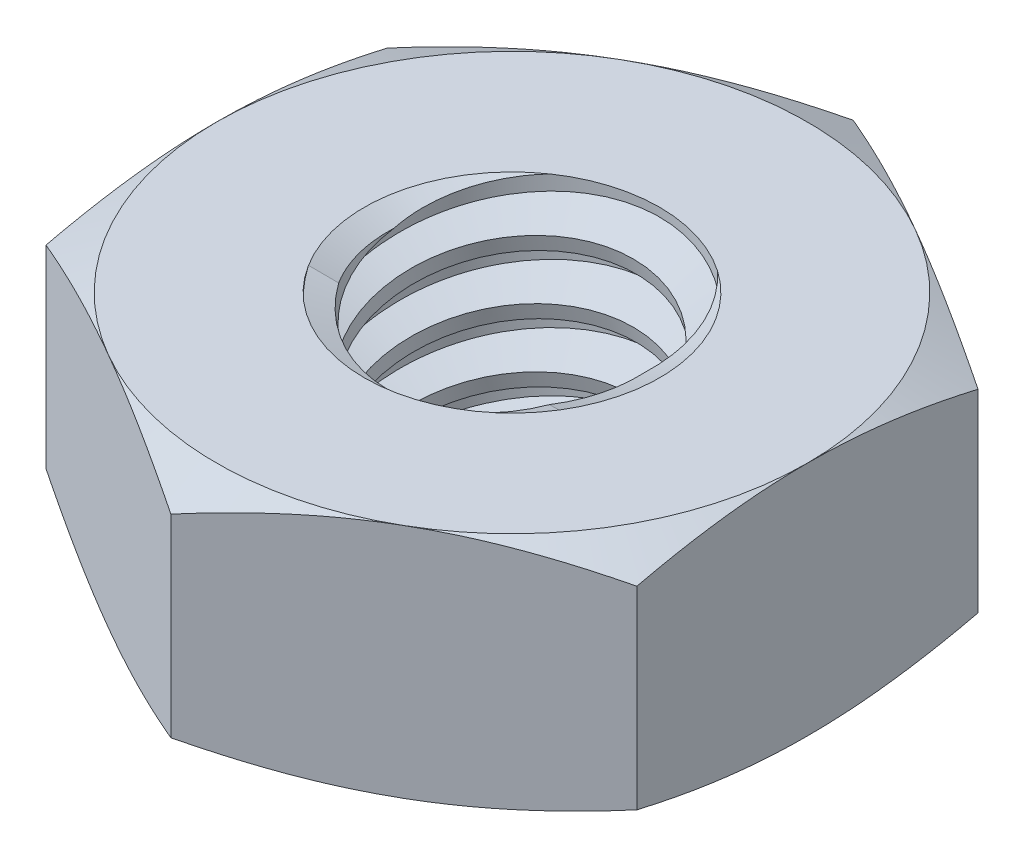
from build123d import *

# Parameters (mm, degrees)
EXTRUDE1_DEPTH       = 0.8
SKETCH2_W            = 1
SKETCH2_H            = 1.6
LPATTERN1_COUNT      = 4
LPATTERN1_PITCH      = 0.4
LPATTERN1_COUNT_DIR2 = 2
LPATTERN1_PITCH_DIR2 = 0.4


with BuildPart() as part:
    # Sketch1 → Extrude1 (new, symmetric)
    with BuildSketch(Plane(origin=(0, 0, 0), x_dir=(1, 0, 0), z_dir=(0, 1, 0))):
        Polygon((0, 2.309401077), (-2, 1.154700538), (-2, -1.154700538), (0, -2.309401077), (2, -1.154700538), (2, 1.154700538), align=None)
    extrude(amount=EXTRUDE1_DEPTH, both=True)

    # Sketch4 → Cut-Revolve2 (revolve, cut)
    with BuildSketch(Plane(origin=(0, 0, 0), x_dir=(0, 0, -1), z_dir=(1, 0, 0))):
        Polygon((0, 0.8), (1, 0.8), (0.82201838, 0.717005807), (0.82201838, -0.717005807), (1, -0.8), (0, -0.8), align=None)
    revolve(axis=Axis((0, 0.8, 0), (0, 1, 0)), mode=Mode.SUBTRACT)


with BuildPart() as body_2:
    # Sketch2 → Revolve1 (revolve)
    with BuildSketch(Plane(origin=(0, 0, 0), x_dir=(0, 0, -1), z_dir=(1, 0, 0))):
        with Locations((0.5, 0)):
            Rectangle(SKETCH2_W, SKETCH2_H)
    revolve(axis=Axis((0, -1.8, 0), (0, 1, 0)))

    # Sketch3 → Cut-Revolve1 (revolve, cut)
    with BuildSketch(Plane(origin=(0, 0, 0), x_dir=(0, 0, -1), z_dir=(1, 0, 0))):
        Polygon((1.009805807, 0.750970966), (1.078446454, 0.40776773), (0.841629993, 0.487879925), (0.82201838, 0.585937993), align=None)
    cut_revolve1 = revolve(axis=Axis((0, 0.8, 0.085891176), (0, -0.9805806756909201, -0.19611613513818438)), mode=Mode.SUBTRACT)

    # LPattern1: Cut-Revolve1 4 × 2
    with Locations(*[Vector(0, -1, 0) * (i * LPATTERN1_PITCH) + Vector(0, 1, 0) * (j * LPATTERN1_PITCH_DIR2) for i in range(LPATTERN1_COUNT) for j in range(LPATTERN1_COUNT_DIR2) if (i, j) != (0, 0)]):
        add(cut_revolve1, mode=Mode.SUBTRACT)


with BuildPart() as part_1:
    add(part.part)

    # Combine1: cut body 2
    add(body_2.part, mode=Mode.SUBTRACT)

    # Sketch5 → Cut-Revolve3 (revolve, cut)
    with BuildSketch(Plane(origin=(0, 0, 0), x_dir=(0, 0, -1), z_dir=(1, 0, 0))):
        Polygon((0, -0.8), (2, -0.8), (2.309401077, -0.655723908), (2.309401077, 0.655723908), (2, 0.8), (0, 0.8), (0, 2.07), (3.579401077, 2.07), (3.579401077, -2.07), (0, -2.07), align=None)
    revolve(axis=Axis((0, -0.8, 0), (0, 1, 0)), mode=Mode.SUBTRACT)


solid = part_1.part
